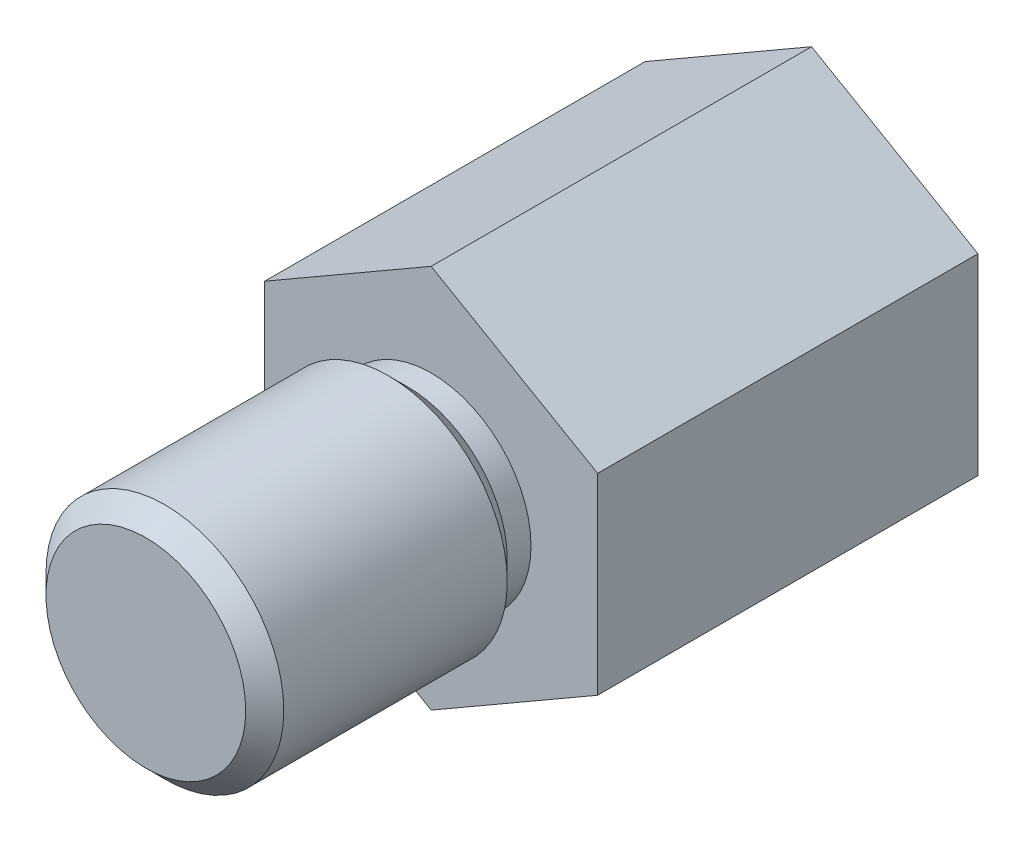
from build123d import *

# Parameters (mm, degrees)
EXTRUDE_1_DEPTH             = 8
SKETCH_2_R                  = 2.5
EXTRUDE_2_DEPTH             = 6
SKETCH_3_R                  = 2.5
SKETCH_3_R_2                = 2.1
CUT_EXTRUDE_3_DEPTH         = 0.5
CHAMFER_1_SIZE              = 0.4
HOLE_WIZARD_M41_D           = 3.3
HOLE_WIZARD_M41_DEPTH       = 6
HOLE_WIZARD_M41_CSINK_D     = 4
HOLE_WIZARD_M41_CSINK_ANGLE = 90
HOLE_WIZARD_M41_TIP         = 0.991420021


with BuildPart() as part:
    # Эскиз1 → Вытянуть1 (new body)
    with BuildSketch(Plane.XY):
        Polygon((0, 4.041451884), (-3.5, 2.020725942), (-3.5, -2.020725942), (0, -4.041451884), (3.5, -2.020725942), (3.5, 2.020725942), align=None)
    extrude(amount=EXTRUDE_1_DEPTH)

    # Эскиз2 → Вытянуть2 (add)
    with BuildSketch(Plane.XY.offset(8)):
        Circle(SKETCH_2_R)
    extrude(amount=EXTRUDE_2_DEPTH)

    # Эскиз3 → Вырез-Вытянуть3 (cut)
    with BuildSketch(Plane.XY.offset(8)):
        Circle(SKETCH_3_R)
        Circle(SKETCH_3_R_2, mode=Mode.SUBTRACT)
    extrude(amount=CUT_EXTRUDE_3_DEPTH, mode=Mode.SUBTRACT)

    # Фаска1
    chamfer_1_edges = [part.edges().sort_by_distance(p)[0] for p in [
        (-2.5, 0, 8.5),
        (-2.5, 0, 14),
    ]]
    chamfer(chamfer_1_edges, length=CHAMFER_1_SIZE - 0.0001)  # a hair under: the kernel refuses the full size

    # Отверстие с зазором M41
    with Locations(Plane(origin=(0, 0, 0), x_dir=(-1, 0, 0), z_dir=(0, 0, -1))):
        with Locations((0, 0)):
            CounterSinkHole(HOLE_WIZARD_M41_D / 2, HOLE_WIZARD_M41_CSINK_D / 2, depth=HOLE_WIZARD_M41_DEPTH, counter_sink_angle=HOLE_WIZARD_M41_CSINK_ANGLE)
            with Locations((0, 0, -(HOLE_WIZARD_M41_DEPTH + HOLE_WIZARD_M41_TIP / 2))):  # 118° drill point
                Cone(0, HOLE_WIZARD_M41_D / 2, HOLE_WIZARD_M41_TIP, mode=Mode.SUBTRACT)


solid = part.part
